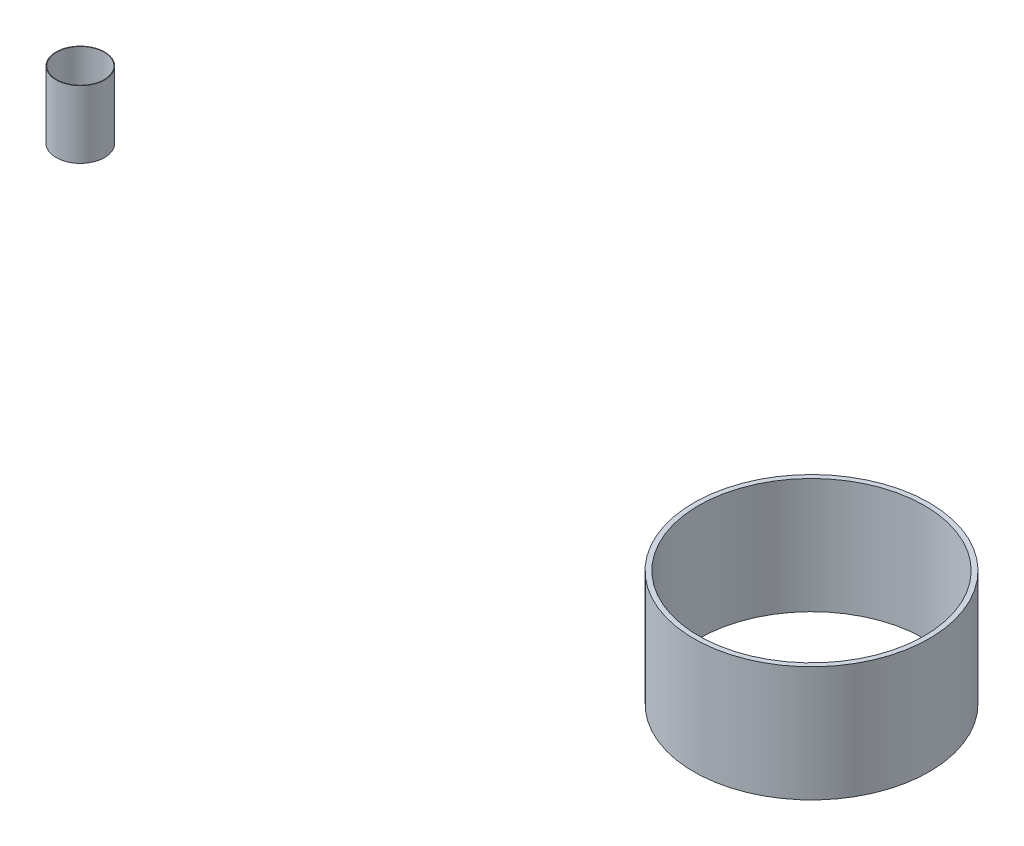
from build123d import *

# Parameters (mm, degrees)
SKETCH_1_R      = 2.449376165
SKETCH_1_R_2    = 2.349376165
EXTRUDE_1_DEPTH = 2.4
SKETCH_2_R      = 0.505
SKETCH_2_R_2    = 0.495
EXTRUDE_3_DEPTH = 1.4


# Read off the part's stored shape, not the designer's step: microservoAssembly.STEP-1/microservoArm_A2.STEP-1-surface1
with BuildPart() as part:
    # 草图1 → 凸台-拉伸1 (new body)
    with BuildSketch(Plane.XZ.offset(-30.765480349)):
        with Locations(Location((2.709389171, 26.076630937, 0), (0, 0, 270))):
            Circle(SKETCH_1_R)
        with Locations(Location((2.709389171, 26.076630937, 0), (0, 0, 270))):
            Circle(SKETCH_1_R_2, mode=Mode.SUBTRACT)
    extrude(amount=-EXTRUDE_1_DEPTH)


with BuildPart() as body_2:
    # 草图2 → 凸台-拉伸3 (new body)
    with BuildSketch(Plane.XZ.offset(-33.265480349)):
        with Locations(Location((-12.490606547, 26.088039712, 0), (0, 0, 270))):
            Circle(SKETCH_2_R)
        with Locations(Location((-12.490606547, 26.088039712, 0), (0, 0, 270))):
            Circle(SKETCH_2_R_2, mode=Mode.SUBTRACT)
    extrude(amount=-EXTRUDE_3_DEPTH)


solid = Compound([part.part, body_2.part])
